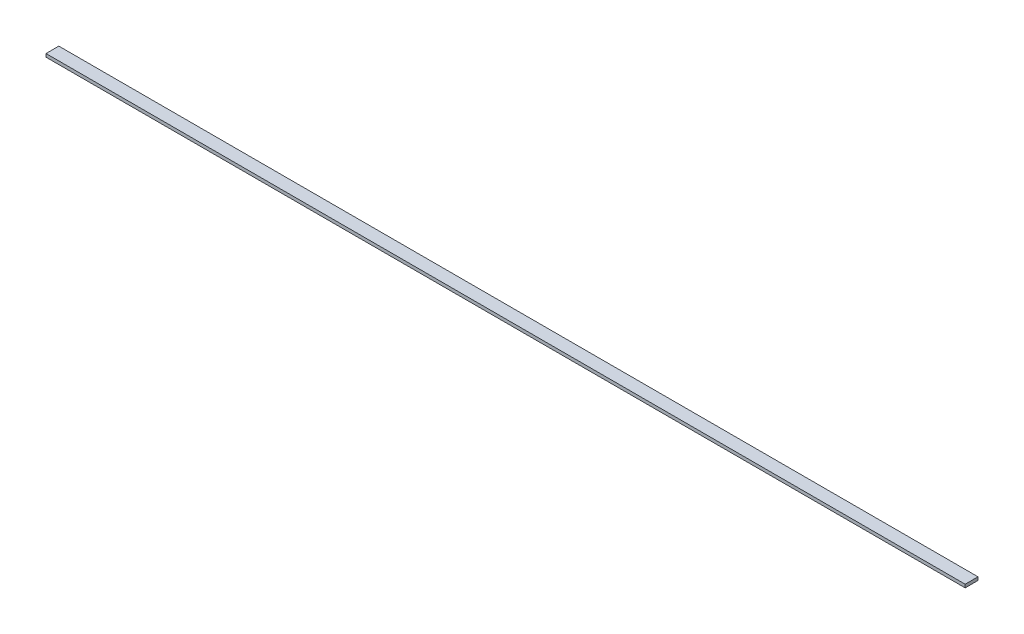
from build123d import *

# Parameters (mm, degrees)
SKETCH1_W           = 430
SKETCH1_H           = 6
BOSS_EXTRUDE1_DEPTH = 1.5


with BuildPart() as part:
    # Sketch1 → Boss-Extrude1 (new body)
    with BuildSketch(Plane(origin=(0, 0, 0), x_dir=(1, 0, 0), z_dir=(0, 1, 0))):
        Rectangle(SKETCH1_W, SKETCH1_H)
    extrude(amount=BOSS_EXTRUDE1_DEPTH)


solid = part.part
